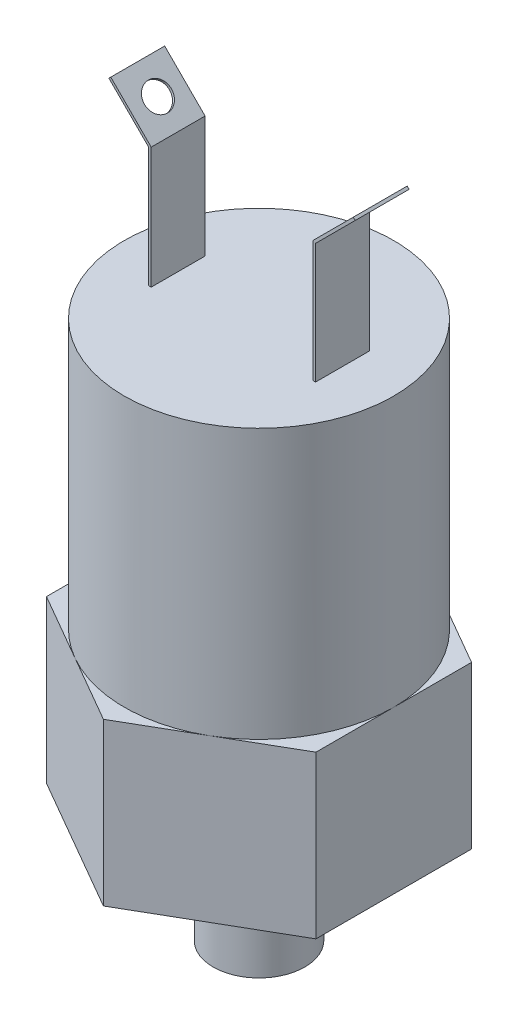
from build123d import *

# Parameters (mm, degrees)
SKETCH1_R           = 4.318
BOSS_EXTRUDE1_DEPTH = 10.16
BOSS_EXTRUDE2_DEPTH = 15.24
SKETCH3_R           = 12.7
BOSS_EXTRUDE3_DEPTH = 25.4
EXTRUDE_THIN1_DEPTH = 2.54
CUT_EXTRUDE1_REACH  = 59.583
SKETCH5_R           = 1.27


with BuildPart() as part:
    # Sketch1 → Boss-Extrude1 (new body)
    with BuildSketch(Plane(origin=(0, 0, 0), x_dir=(1, 0, 0), z_dir=(0, 1, 0))):
        Circle(SKETCH1_R)
    extrude(amount=BOSS_EXTRUDE1_DEPTH)

    # Sketch2 → Boss-Extrude2 (add)
    with BuildSketch(Plane(origin=(0, 10.16, 0), x_dir=(1, 0, 0), z_dir=(0, 1, 0))):
        Polygon((0, 14.664696837), (-12.7, 7.332348419), (-12.7, -7.332348419), (0, -14.664696837), (12.7, -7.332348419), (12.7, 7.332348419), align=None)
    extrude(amount=BOSS_EXTRUDE2_DEPTH)

    # Sketch3 → Boss-Extrude3 (add)
    with BuildSketch(Plane(origin=(0, 25.4, 0), x_dir=(1, 0, 0), z_dir=(0, 1, 0))):
        Circle(SKETCH3_R)
    extrude(amount=BOSS_EXTRUDE3_DEPTH)

    # Sketch4 → Extrude-Thin1 (add, symmetric)
    with BuildSketch(Plane.XY):
        Polygon((7.62, 50.8), (7.62, 62.23), (11.43, 66.04), (11.609605122, 65.860394878), (7.874, 62.124789755), (7.874, 50.8), align=None)
    extrude_thin1 = extrude(amount=EXTRUDE_THIN1_DEPTH, both=True)

    # Sketch5 → Cut-Extrude1 (cut, up to next)
    with BuildSketch(Plane(origin=(-27.305, 27.305, 0), x_dir=(0, 0, 1), z_dir=(-0.7071067811865452, 0.7071067811865498, 0)), mode=Mode.PRIVATE) as cut_extrude1_sk1:
        with Locations((0, 52.085485502)):
            Circle(SKETCH5_R)
    cut_extrude1_tool1 = extrude(cut_extrude1_sk1.sketch, amount=-CUT_EXTRUDE1_REACH, mode=Mode.PRIVATE) & part.part
    cut_extrude1 = cut_extrude1_tool1.solids().sort_by_distance((9.525, 64.135, 0))[0]
    add(cut_extrude1, mode=Mode.SUBTRACT)

    # Mirror1: Extrude-Thin1, Cut-Extrude1 across plane
    add(extrude_thin1.mirror(Plane(origin=(0, 0, 0), x_dir=(0, 0, 1), z_dir=(1, 0, 0))))
    add(cut_extrude1.mirror(Plane(origin=(0, 0, 0), x_dir=(0, 0, 1), z_dir=(1, 0, 0))), mode=Mode.SUBTRACT)


solid = part.part
